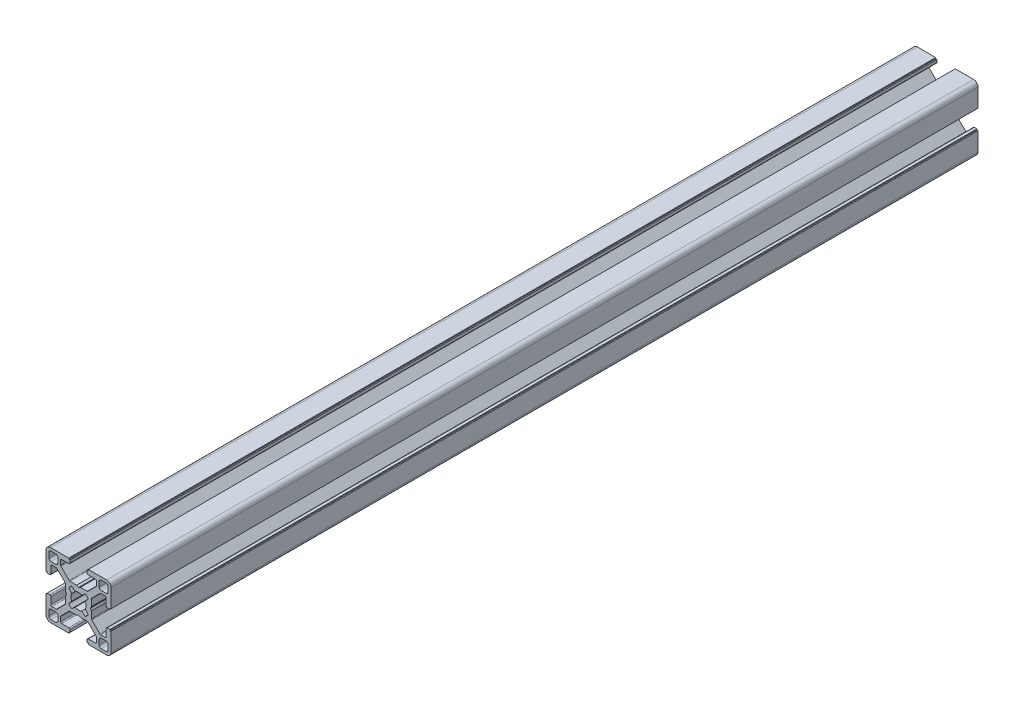
from build123d import *

# Parameters (mm, degrees)
BOSS_EXTRUDE1_DEPTH = 200
CIRPATTERN1_COUNT   = 4


with BuildPart() as part:
    # Sketch3 → Boss-Extrude1 (new, symmetric)
    with BuildSketch(Plane.XY):
        with BuildLine():
            Line((-4.503841895, 3.156803476), (-3.14772708, 1.530298739))
            ThreePointArc((-3.14772708, 1.530298739), (-3.410794979, 0.785160882), (-3.5, 0))
            Line((-3.5, 0), (-5.5, 0))
            Line((-5.5, 0), (-6, 0.866025404))
            Line((-6, 0.866025404), (-6, 3.996841995))
            ThreePointArc((-6, 3.996841995), (-6.038060234, 4.188183711), (-6.146446609, 4.350395385))
            Line((-6.146446609, 4.350395385), (-9.917104615, 8.121053391))
            ThreePointArc((-9.917104615, 8.121053391), (-10.079316289, 8.229439766), (-10.270658005, 8.2675))
            Line((-10.270658005, 8.2675), (-12.29, 8.2675))
            ThreePointArc((-12.29, 8.2675), (-12.643553391, 8.121053391), (-12.79, 7.7675))
            Line((-12.79, 7.7675), (-12.79, 4.5))
            ThreePointArc((-12.79, 4.5), (-12.936446609, 4.146446609), (-13.29, 4))
            Line((-13.29, 4), (-14.5, 4))
            Line((-14.5, 4), (-14.5, 4.5))
            Line((-14.5, 4.5), (-15, 4.5))
            Line((-15, 4.5), (-15, 12.968))
            ThreePointArc((-15, 12.968), (-14.404840979, 14.404840979), (-12.968, 15))
            Line((-12.968, 15), (-4.5, 15))
            Line((-4.5, 15), (-4.5, 14.5))
            Line((-4.5, 14.5), (-4, 14.5))
            Line((-4, 14.5), (-4, 13.29))
            ThreePointArc((-4, 13.29), (-4.146446609, 12.936446609), (-4.5, 12.79))
            Line((-4.5, 12.79), (-7.7675, 12.79))
            ThreePointArc((-7.7675, 12.79), (-8.121053391, 12.643553391), (-8.2675, 12.29))
            Line((-8.2675, 12.29), (-8.2675, 10.270658005))
            ThreePointArc((-8.2675, 10.270658005), (-8.229439766, 10.079316289), (-8.121053391, 9.917104615))
            Line((-8.121053391, 9.917104615), (-4.350395385, 6.146446609))
            ThreePointArc((-4.350395385, 6.146446609), (-4.188183711, 6.038060234), (-3.996841995, 6))
            Line((-3.996841995, 6), (-0.866025404, 6))
            Line((-0.866025404, 6), (0, 5.5))
            Line((0, 5.5), (0, 3.5))
            ThreePointArc((0, 3.5), (-0.785160882, 3.410794979), (-1.530298739, 3.14772708))
            Line((-1.530298739, 3.14772708), (-3.156803476, 4.503841895))
            ThreePointArc((-3.156803476, 4.503841895), (-3.889087297, 3.889087297), (-4.503841895, 3.156803476))
        make_face()
        with BuildLine():
            Line((-12.705, 9.5135), (-10.5135, 9.5135))
            ThreePointArc((-10.5135, 9.5135), (-9.806393219, 9.806393219), (-9.5135, 10.5135))
            Line((-9.5135, 10.5135), (-9.5135, 12.705))
            ThreePointArc((-9.5135, 12.705), (-9.806393219, 13.412106781), (-10.5135, 13.705))
            Line((-10.5135, 13.705), (-12.705, 13.705))
            ThreePointArc((-12.705, 13.705), (-13.412106781, 13.412106781), (-13.705, 12.705))
            Line((-13.705, 12.705), (-13.705, 10.5135))
            ThreePointArc((-13.705, 10.5135), (-13.412106781, 9.806393219), (-12.705, 9.5135))
        make_face(mode=Mode.SUBTRACT)
    boss_extrude1 = extrude(amount=BOSS_EXTRUDE1_DEPTH, both=True)

    # CirPattern1: Boss-Extrude1 ×4 about axis
    cirpattern1_axis = Axis((0, 0, 76.2), (0, 0, -1))
    for i in range(1, CIRPATTERN1_COUNT):
        add(boss_extrude1.rotate(cirpattern1_axis, i * 360 / CIRPATTERN1_COUNT))


solid = part.part
